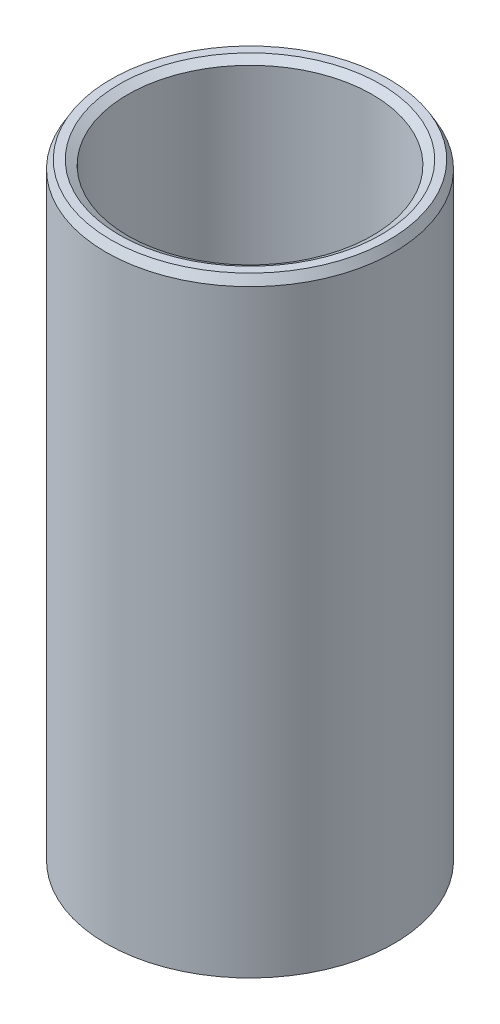
from build123d import *
from OCP.BRepFilletAPI import BRepFilletAPI_MakeChamfer

# Parameters (mm, degrees)
SKETCH1_R           = 55
BOSS_EXTRUDE1_DEPTH = 233.828254304
SKETCH2_R           = 46.732968036
CUT_EXTRUDE1_DEPTH  = 247.42575456
CHAMFER1_SIZE       = 3.190456574
CHAMFER1_SIZE2      = 1.842010962


with BuildPart() as part:
    # Sketch1 → Boss-Extrude1 (new body)
    with BuildSketch(Plane(origin=(0, 0, 0), x_dir=(1, 0, 0), z_dir=(0, 1, 0))):
        Circle(SKETCH1_R)
    extrude(amount=BOSS_EXTRUDE1_DEPTH)

    # Sketch2 → Cut-Extrude1 (cut, through all)
    with BuildSketch(Plane(origin=(0, 0, 0), x_dir=(1, 0, 0), z_dir=(0, 1, 0))):
        Circle(SKETCH2_R)
    extrude(amount=CUT_EXTRUDE1_DEPTH, mode=Mode.SUBTRACT)

    # Chamfer1: one chamfer whose edges measure the first distance from different faces: ONE call of the kernel's chamfer builder (chamfer() names one face for all edges)
    chamfer1_edges_1 = [part.edges().sort_by_distance(p)[0] for p in [
        (-46.732968036, 233.828254304, 0),
    ]]
    chamfer1_side_1 = [part.faces().sort_by_distance(p)[0] for p in [
        (-53.444365081, 233.828254304, 0),
    ]]
    chamfer1_edges_2 = [part.edges().sort_by_distance(p)[0] for p in [
        (-46.732968036, 0, 0),
    ]]
    chamfer1_side_2 = [part.faces().sort_by_distance(p)[0] for p in [
        (-46.732968036, 116.914127152, 0),
    ]]
    chamfer1_edges_3 = [part.edges().sort_by_distance(p)[0] for p in [
        (-55, 0, 0),
    ]]
    chamfer1_side_3 = [part.faces().sort_by_distance(p)[0] for p in [
        (-53.444365081, 0, 0),
    ]]
    chamfer1_edges_4 = [part.edges().sort_by_distance(p)[0] for p in [
        (-55, 233.828254304, 0),
    ]]
    chamfer1_side_4 = [part.faces().sort_by_distance(p)[0] for p in [
        (-55, 116.914127152, 0),
    ]]
    chamfer1 = BRepFilletAPI_MakeChamfer(part.part.solid().wrapped)
    for e in chamfer1_edges_1:
        chamfer1.Add(CHAMFER1_SIZE, CHAMFER1_SIZE2, e.wrapped, chamfer1_side_1[0].wrapped)  # the first distance lies on this face
    for e in chamfer1_edges_2:
        chamfer1.Add(CHAMFER1_SIZE, CHAMFER1_SIZE2, e.wrapped, chamfer1_side_2[0].wrapped)  # the first distance lies on this face
    for e in chamfer1_edges_3:
        chamfer1.Add(CHAMFER1_SIZE, CHAMFER1_SIZE2, e.wrapped, chamfer1_side_3[0].wrapped)  # the first distance lies on this face
    for e in chamfer1_edges_4:
        chamfer1.Add(CHAMFER1_SIZE, CHAMFER1_SIZE2, e.wrapped, chamfer1_side_4[0].wrapped)  # the first distance lies on this face
    add(Compound.cast(chamfer1.Shape()), mode=Mode.REPLACE)


solid = part.part
